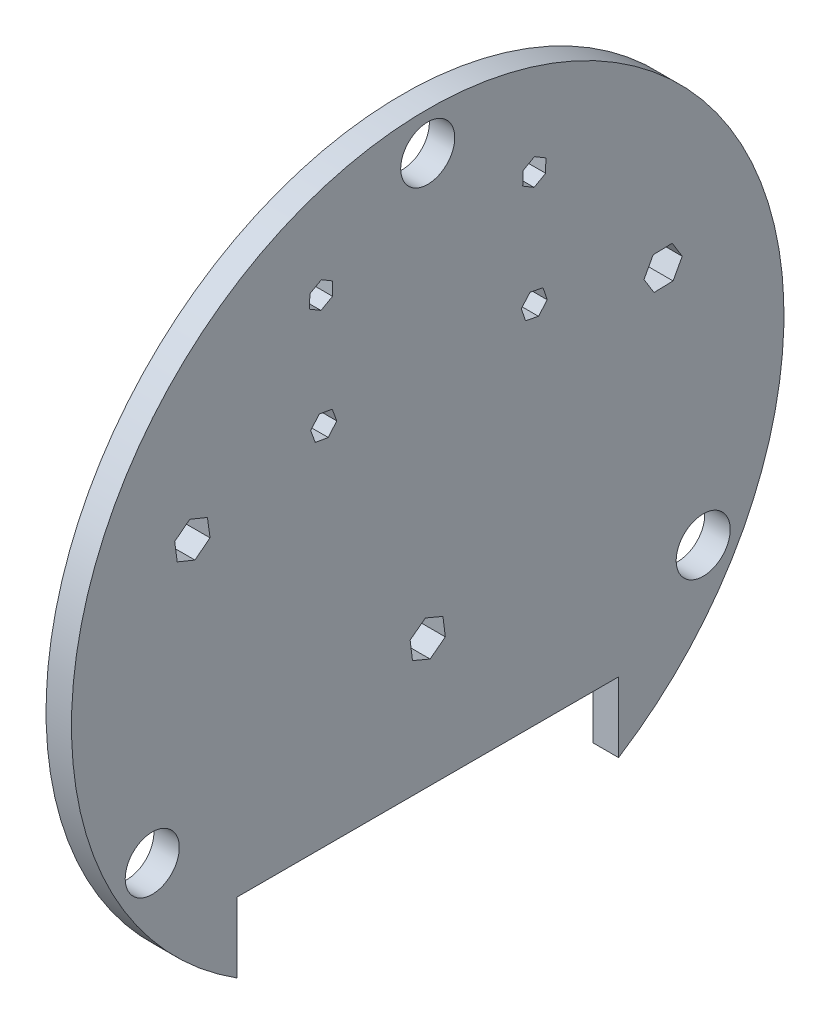
from build123d import *

# Parameters (mm, degrees)
SKETCH1_R           = 56
BOSS_EXTRUDE1_DEPTH = 4
SKETCH2_R           = 4.25
CUT_EXTRUDE1_DEPTH  = 80.296910406
CUT_EXTRUDE2_DEPTH  = 80.296910406
CUT_EXTRUDE3_DEPTH  = 80.296910406


with BuildPart() as part:
    # Sketch1 → Boss-Extrude1 (new body)
    with BuildSketch(Plane(origin=(0, 0, 0), x_dir=(0, 0, -1), z_dir=(1, 0, 0))):
        Circle(SKETCH1_R)
    extrude(amount=BOSS_EXTRUDE1_DEPTH)

    # Sketch2 → Cut-Extrude1 (cut, through all)
    with BuildSketch(Plane.ZY):
        with Locations((0, 50)):
            Circle(SKETCH2_R)
        with Locations((43.301270189, -25)):
            Circle(SKETCH2_R)
        with Locations((-43.301270189, -25)):
            Circle(SKETCH2_R)
    extrude(amount=-CUT_EXTRUDE1_DEPTH, mode=Mode.SUBTRACT)

    # Sketch3 → Cut-Extrude2 (cut, through all)
    with BuildSketch(Plane.ZY):
        with BuildLine():
            Line((-30, -47.28636167), (-30, -36.28636167))
            Line((-30, -36.28636167), (30, -36.28636167))
            Line((30, -36.28636167), (30, -47.28636167))
            ThreePointArc((30, -47.28636167), (0, -56), (-30, -47.28636167))
        make_face()
    extrude(amount=-CUT_EXTRUDE2_DEPTH, mode=Mode.SUBTRACT)

    # Sketch4 → Cut-Extrude3 (cut, through all)
    with BuildSketch(Plane(origin=(4, 0, 0), x_dir=(0, 0, -1), z_dir=(1, 0, 0))):
        Polygon((16.778893082, 41.136970451), (14.964620468, 40.122862526), (14.935727386, 38.044602391), (16.721106918, 36.98045018), (18.535379532, 37.994558105), (18.564272614, 40.07281824), align=None)
        Polygon((-16.722592315, 41.136990571), (-18.536139655, 40.121586195), (-18.56354734, 38.04330594), (-16.777407685, 36.980430061), (-14.963860345, 37.995834437), (-14.93645266, 40.074114692), align=None)
        Polygon((16.088231144, 23.029005213), (14.712790138, 21.470749124), (15.374558994, 19.500454227), (17.411768856, 19.088415419), (18.787209862, 20.646671508), (18.125441006, 22.616966405), align=None)
        Polygon((-17.061235196, 23.01520486), (-18.394726707, 21.420902383), (-17.680766017, 19.46891362), (-15.633313814, 19.111227334), (-14.299822303, 20.705529811), (-15.013782994, 22.657518574), align=None)
        Polygon((35.430482848, 18.443659426), (33.998833986, 15.804774269), (35.568351138, 13.245487407), (38.569517152, 13.325085702), (40.001166014, 15.963970859), (38.431648862, 18.523257721), align=None)
        Polygon((-39.778519279, 17.021546231), (-39.374080923, 14.046691117), (-36.595561644, 12.90951745), (-34.221480721, 14.747198897), (-34.625919077, 17.722054012), (-37.404438356, 18.859227678), align=None)
        Polygon((-2.766739822, -14.905238413), (-2.392757383, -17.884075513), (0.373982439, -19.049615771), (2.766739822, -17.236318928), (2.392757383, -14.257481828), (-0.373982439, -13.091941571), align=None)
    extrude(amount=-CUT_EXTRUDE3_DEPTH, mode=Mode.SUBTRACT)


solid = part.part
